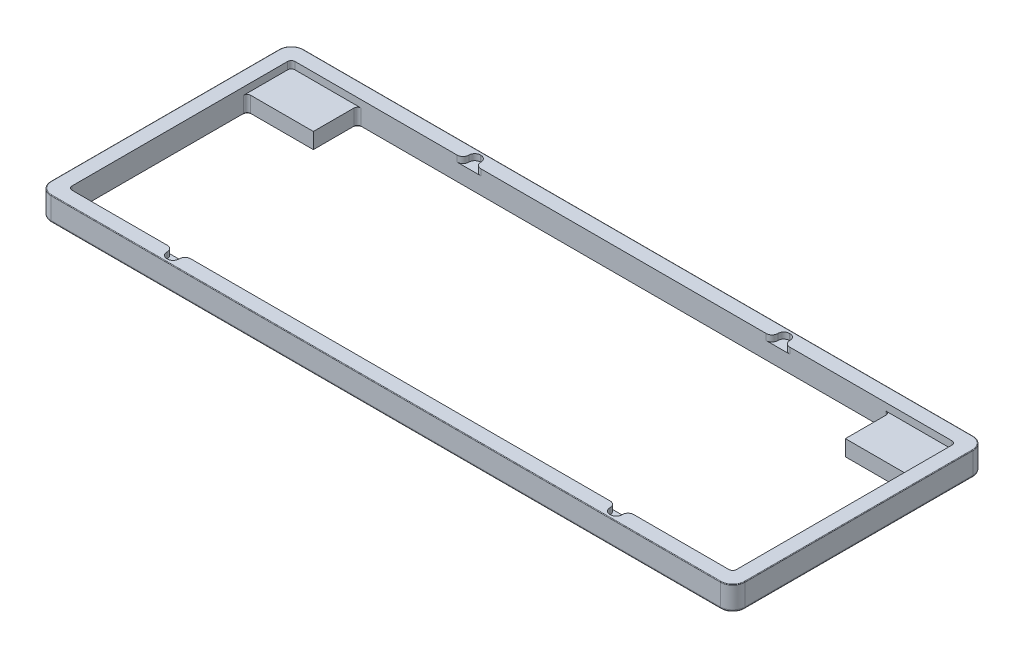
from build123d import *

# Parameters (mm, degrees)
BOSS_EXTRUDE1_DEPTH      = 7.8
BOSS_EXTRUDE1_DEPTH_BACK = 2.65
SKETCH1_W                = 299.45
SKETCH1_H                = 108.950000082
CUT_EXTRUDE1_START       = 2.65
SKETCH3_W                = 28.574999543
SKETCH3_H                = 19.050000082
SKETCH3_W_2              = 28.575000457
CUT_EXTRUDE1_DEPTH       = 3.15
CUT_EXTRUDE2_START       = -98.183332877
CUT_EXTRUDE2_OUTLINE_W   = 2.65
CUT_EXTRUDE2_OUTLINE_H   = 5.129290046
CUT_EXTRUDE2_DEPTH       = 5.2
CUT_EXTRUDE2_START_2     = 92.983332877
CUT_EXTRUDE2_2_OUTLINE_W = 2.65
CUT_EXTRUDE2_2_OUTLINE_H = 5.129290046
CUT_EXTRUDE2_2_DEPTH     = 5.2
CUT_EXTRUDE2_START_3     = -69.275
CUT_EXTRUDE2_3_OUTLINE_W = 2.65
CUT_EXTRUDE2_3_OUTLINE_H = 5.070709954
CUT_EXTRUDE2_3_DEPTH     = 5.2
CUT_EXTRUDE2_START_4     = 64.075
CUT_EXTRUDE2_4_OUTLINE_W = 2.65
CUT_EXTRUDE2_4_OUTLINE_H = 5.070709954
CUT_EXTRUDE2_4_DEPTH     = 5.2
FILLET1_R                = 5.25
FILLET2_R                = 1.55
FILLET3_R                = 0.25
CHAMFER1_SIZE            = 0.5
FILLET4_R                = 1
FILLET7_R                = 2.5


# Read off the part's stored shape, not the designer's step: Cut-Extrude2
with BuildPart() as part:
    # Sketch1 → Boss-Extrude1 (new, two sides: drawn at the far end of the back side and taken through both)
    with BuildSketch(Plane.XZ.offset(-BOSS_EXTRUDE1_DEPTH_BACK)):
        with Locations((0.005996207, -0.029290046)):
            Rectangle(SKETCH1_W, SKETCH1_H)
        Polygon((-143.369003793, 48.095709995), (143.380996207, 48.095709995), (143.380996207, -29.104290005), (114.80599575, -29.104290005), (114.80599575, -48.154290087), (-114.79400425, -48.154290087), (-114.79400425, -29.104290005), (-143.369003793, -29.104290005), align=None, mode=Mode.SUBTRACT)
    extrude(amount=BOSS_EXTRUDE1_DEPTH + BOSS_EXTRUDE1_DEPTH_BACK)

    # Sketch3 → Cut-Extrude1 (cut)
    with BuildSketch(Plane(origin=(0, 0, 0), x_dir=(1, 0, 0), z_dir=(0, 1, 0)).offset(CUT_EXTRUDE1_START)):
        with Locations((-129.081504021, 38.629290046)):
            Rectangle(SKETCH3_W, SKETCH3_H)
        with Locations((129.093495979, 38.629290046)):
            Rectangle(SKETCH3_W_2, SKETCH3_H)
    extrude(amount=-CUT_EXTRUDE1_DEPTH, mode=Mode.SUBTRACT)

    # Cut-Extrude2 outline → Cut-Extrude2 (cut)
    with BuildSketch(Plane.YZ.offset(CUT_EXTRUDE2_START)):
        with Locations((1.325, 50.660355018)):
            Rectangle(CUT_EXTRUDE2_OUTLINE_W, CUT_EXTRUDE2_OUTLINE_H)
    extrude(amount=CUT_EXTRUDE2_DEPTH, mode=Mode.SUBTRACT)

    # Cut-Extrude2 2 outline → Cut-Extrude2 2 (cut)
    with BuildSketch(Plane.YZ.offset(CUT_EXTRUDE2_START_2)):
        with Locations((1.325, 50.660355018)):
            Rectangle(CUT_EXTRUDE2_2_OUTLINE_W, CUT_EXTRUDE2_2_OUTLINE_H)
    extrude(amount=CUT_EXTRUDE2_2_DEPTH, mode=Mode.SUBTRACT)

    # Cut-Extrude2 3 outline → Cut-Extrude2 3 (cut)
    with BuildSketch(Plane.YZ.offset(CUT_EXTRUDE2_START_3)):
        with Locations((1.325, -50.689645064)):
            Rectangle(CUT_EXTRUDE2_3_OUTLINE_W, CUT_EXTRUDE2_3_OUTLINE_H)
    extrude(amount=CUT_EXTRUDE2_3_DEPTH, mode=Mode.SUBTRACT)

    # Cut-Extrude2 4 outline → Cut-Extrude2 4 (cut)
    with BuildSketch(Plane.YZ.offset(CUT_EXTRUDE2_START_4)):
        with Locations((1.325, -50.689645064)):
            Rectangle(CUT_EXTRUDE2_4_OUTLINE_W, CUT_EXTRUDE2_4_OUTLINE_H)
    extrude(amount=CUT_EXTRUDE2_4_DEPTH, mode=Mode.SUBTRACT)

    # Fillet1
    fillet1_edges = [part.edges().sort_by_distance(p)[0] for p in [
        (-149.719003793, -2.575, 54.445709995),
        (149.730996207, -2.575, 54.445709995),
        (149.730996207, -2.575, -54.504290087),
        (-149.719003793, -2.575, -54.504290087),
    ]]
    fillet(fillet1_edges, radius=FILLET1_R)

    # Fillet2
    fillet2_edges = [part.edges().sort_by_distance(p)[0] for p in [
        (-143.369003793, -2.575, 48.095709995),
        (143.380996207, -2.575, 48.095709995),
        (-143.369003793, -4.15, -29.104290005),
        (-114.79400425, -4.15, -48.154290087),
        (114.80599575, -4.15, -48.154290087),
        (143.380996207, -4.15, -29.104290005),
        (-143.369003793, 1.075, -48.154290087),
        (143.380996207, 1.075, -48.154290087),
    ]]
    fillet(fillet2_edges, radius=FILLET2_R)

    # Fillet3
    fillet3_edges = [part.edges().sort_by_distance(p)[0] for p in [
        (-149.719003793, 2.65, -0.029290046),
        (0.005996207, 2.65, -54.504290087),
        (0.005996207, 2.65, 54.445709995),
        (149.730996207, 2.65, -0.029290046),
        (-148.181314394, 2.65, 52.908020596),
        (148.193306808, 2.65, 52.908020596),
        (148.193306808, 2.65, -52.966600688),
        (-148.181314394, 2.65, -52.966600688),
    ]]
    fillet(fillet3_edges, radius=FILLET3_R)

    # Chamfer1
    chamfer1_edges = [part.edges().sort_by_distance(p)[0] for p in [
        (0.00599575, -7.8, -48.154290087),
        (143.380996207, -7.8, 9.495709995),
        (-143.369003793, -7.8, 9.495709995),
        (114.80599575, -7.8, -37.854290046),
        (0.005996207, -7.8, 48.095709995),
        (-128.306504021, -7.8, -29.104290005),
        (114.352011261, -7.8, -47.700305598),
        (142.927011718, -7.8, -28.650305516),
        (142.927011718, -7.8, 47.641725506),
        (-114.34001976, -7.8, -47.700305598),
        (-142.915019304, -7.8, -28.650305516),
        (-142.915019304, -7.8, 47.641725506),
        (-114.79400425, -7.8, -37.854290046),
        (128.318495979, -7.8, -29.104290005),
    ]]
    chamfer(chamfer1_edges, length=CHAMFER1_SIZE)

    # Fillet4
    fillet4_edges = [part.edges().sort_by_distance(p)[0] for p in [
        (-149.719003793, -7.8, -0.029290046),
        (0.005996207, -7.8, -54.504290087),
        (149.730996207, -7.8, -0.029290046),
        (0.005996207, -7.8, 54.445709995),
        (-148.181314394, -7.8, 52.908020596),
        (148.193306808, -7.8, 52.908020596),
        (148.193306808, -7.8, -52.966600688),
        (-148.181314394, -7.8, -52.966600688),
    ]]
    fillet(fillet4_edges, radius=FILLET4_R)

    # Fillet7
    fillet7_edges = [part.edges().sort_by_distance(p)[0] for p in [
        (-98.183332877, 1.325, 53.225000041),
        (-92.983332877, 1.325, 53.225000041),
        (92.983332877, 1.325, 53.225000041),
        (98.183332877, 1.325, 53.225000041),
        (69.275, 1.325, -53.225000041),
        (64.075, 1.325, -53.225000041),
        (-64.075, 1.325, -53.225000041),
        (-69.275, 1.325, -53.225000041),
        (-69.275, 1.325, -48.154290087),
        (-64.075, 1.325, -48.154290087),
        (69.275, 1.325, -48.154290087),
        (64.075, 1.325, -48.154290087),
        (92.983332877, 1.325, 48.095709995),
        (98.183332877, 1.325, 48.095709995),
        (-98.183332877, 1.325, 48.095709995),
        (-92.983332877, 1.325, 48.095709995),
    ]]
    fillet(fillet7_edges, radius=FILLET7_R)


solid = part.part
